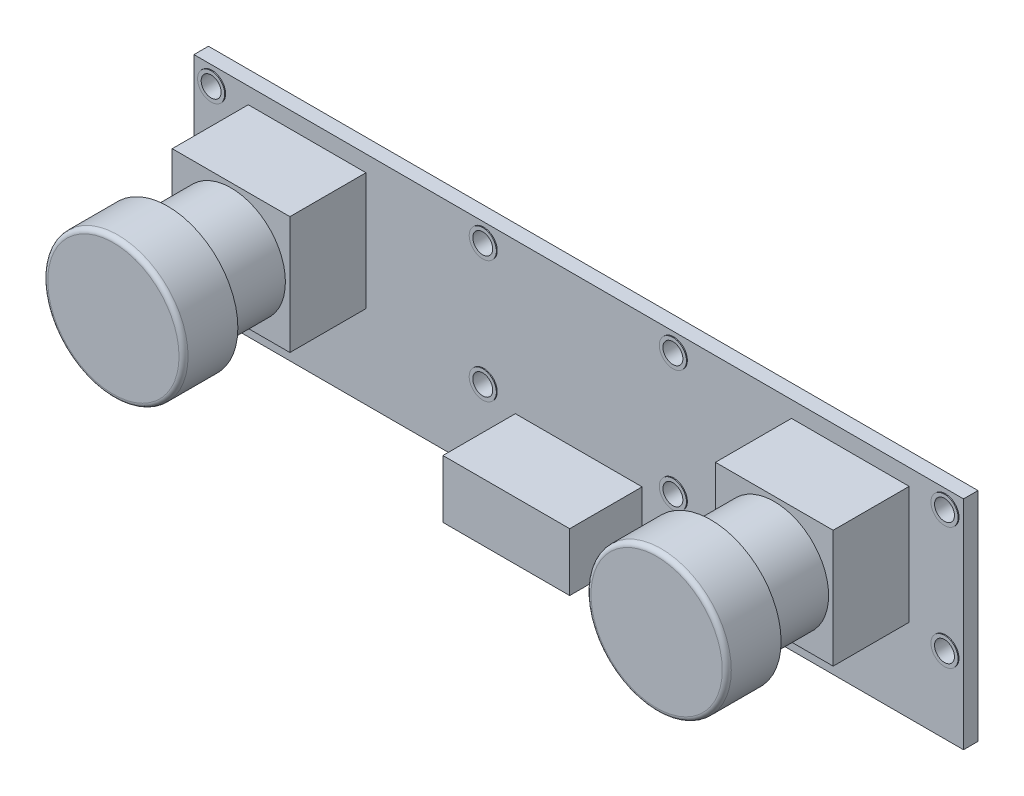
from build123d import *

# Parameters (mm, degrees)
SKETCH4_W            = 85
SKETCH4_H            = 24
BOSS_EXTRUDE4_DEPTH  = 1.6
SKETCH5_R            = 1.1
CUT_EXTRUDE1_DEPTH   = 1.6
SKETCH6_W            = 13
SKETCH6_H            = 13
BOSS_EXTRUDE5_DEPTH  = 8.4
SKETCH7_R            = 6
BOSS_EXTRUDE6_DEPTH  = 7
SKETCH8_R            = 7.75
BOSS_EXTRUDE7_DEPTH  = 6
SKETCH9_R            = 6
BOSS_EXTRUDE8_DEPTH  = 7
SKETCH10_R           = 7.75
BOSS_EXTRUDE9_DEPTH  = 6
BOSS_EXTRUDE10_DEPTH = 8
SKETCH12_W           = 14
SKETCH12_H           = 1
CUT_EXTRUDE2_DEPTH   = 8
SHELL1_START         = 1
SHELL1_OUTLINE_W     = 12
SHELL1_OUTLINE_H     = 5.4
SHELL1_DEPTH         = 7.6
SKETCH14_R           = 0.75
BOSS_EXTRUDE11_DEPTH = 5
FILLET1_R            = 0.5
FILLET2_R            = 0.5
BOSS_EXTRUDE12_START = 0.1
SKETCH15_R           = 1.5
SKETCH15_R_2         = 1.1
BOSS_EXTRUDE12_DEPTH = 0.1


# Read off the part's stored shape, not the designer's step: Shell1
with BuildPart() as part:
    # Sketch4 → Boss-Extrude4 (new body)
    with BuildSketch(Plane.XY):
        Rectangle(SKETCH4_W, SKETCH4_H)
    extrude(amount=BOSS_EXTRUDE4_DEPTH)

    # Sketch5 → Cut-Extrude1 (cut)
    with BuildSketch(Plane.XY.offset(1.6)):
        with Locations((-40.5, 10)):
            Circle(SKETCH5_R)
        with Locations((-40.5, -3.5)):
            Circle(SKETCH5_R)
        with Locations((-10.5, -3.5)):
            Circle(SKETCH5_R)
        with Locations((-10.5, 10)):
            Circle(SKETCH5_R)
        with Locations((10.5, 10)):
            Circle(SKETCH5_R)
        with Locations((10.5, -3.5)):
            Circle(SKETCH5_R)
        with Locations((40.5, 10)):
            Circle(SKETCH5_R)
        with Locations((40.5, -3.5)):
            Circle(SKETCH5_R)
    extrude(amount=-CUT_EXTRUDE1_DEPTH, mode=Mode.SUBTRACT)

    # Sketch6 → Boss-Extrude5 (add)
    with BuildSketch(Plane.XY.offset(1.6)):
        with Locations((-30, 3.7)):
            Rectangle(SKETCH6_W, SKETCH6_H)
        with Locations((30, 3.7)):
            Rectangle(SKETCH6_W, SKETCH6_H)
    extrude(amount=BOSS_EXTRUDE5_DEPTH)

    # Sketch7 → Boss-Extrude6 (add)
    with BuildSketch(Plane.XY.offset(10)):
        with Locations((-30, 3.7)):
            Circle(SKETCH7_R)
    extrude(amount=BOSS_EXTRUDE6_DEPTH)

    # Sketch8 → Boss-Extrude7 (add)
    with BuildSketch(Plane.XY.offset(17)):
        with Locations((-30, 3.7)):
            Circle(SKETCH8_R)
    extrude(amount=BOSS_EXTRUDE7_DEPTH)

    # Sketch11 → Boss-Extrude10 (add)
    with BuildSketch(Plane.XY.offset(1.6)):
        Polygon((0, -12), (7, -12), (7, -4.6), (-7, -4.6), (-7, -12), align=None)
    extrude(amount=BOSS_EXTRUDE10_DEPTH)

    # Sketch12 → Cut-Extrude2 (cut)
    with BuildSketch(Plane.XY.offset(9.6)):
        with Locations((0, -11.5)):
            Rectangle(SKETCH12_W, SKETCH12_H)
    extrude(amount=-CUT_EXTRUDE2_DEPTH, mode=Mode.SUBTRACT)

    # Shell1 outline → Shell1 (cut)
    with BuildSketch(Plane.XY.offset(SHELL1_START)):
        with Locations((0, -8.3)):
            Rectangle(SHELL1_OUTLINE_W, SHELL1_OUTLINE_H)
    extrude(amount=SHELL1_DEPTH, mode=Mode.SUBTRACT)

    # Sketch14 → Boss-Extrude11 (add)
    with BuildSketch(Plane(origin=(0, -5.6, 0), x_dir=(-1, 0, 0), z_dir=(0, -1, 0))):
        with Locations(Location((5, -5, 0), (0, 0, 90))):
            Circle(SKETCH14_R)
        with Locations(Location((-5, -5, 0), (0, 0, 90))):
            Circle(SKETCH14_R)
        with Locations(Location((1.666666667, -5, 0), (0, 0, 90))):
            Circle(SKETCH14_R)
        with Locations(Location((-1.668333333, -5, 0), (0, 0, 90))):
            Circle(SKETCH14_R)
    extrude(amount=BOSS_EXTRUDE11_DEPTH)

    # Fillet1
    fillet1_edges = [part.edges().sort_by_distance(p)[0] for p in [
        (-37.75, 3.7, 23),
    ]]
    fillet(fillet1_edges, radius=FILLET1_R)

    # Sketch15 → Boss-Extrude12 (add)
    # profile 1 of 8: a face of its own
    with BuildSketch(Plane.XY.offset(1.6).offset(BOSS_EXTRUDE12_START)):
        with Locations(Location((-10.5, 10, 0), (0, 0, 180))):
            Circle(SKETCH15_R)
        with Locations((-10.5, 10)):
            Circle(SKETCH15_R_2, mode=Mode.SUBTRACT)
    # profile 2 of 8: a face of its own
    with BuildSketch(Plane.XY.offset(1.6).offset(BOSS_EXTRUDE12_START)):
        with Locations(Location((-10.5, -3.5, 0), (0, 0, 180))):
            Circle(SKETCH15_R)
        with Locations((-10.5, -3.5)):
            Circle(SKETCH15_R_2, mode=Mode.SUBTRACT)
    # profile 3 of 8: a face of its own
    with BuildSketch(Plane.XY.offset(1.6).offset(BOSS_EXTRUDE12_START)):
        with Locations(Location((-40.5, 10, 0), (0, 0, 180))):
            Circle(SKETCH15_R)
        with Locations((-40.5, 10)):
            Circle(SKETCH15_R_2, mode=Mode.SUBTRACT)
    # profile 4 of 8: a face of its own
    with BuildSketch(Plane.XY.offset(1.6).offset(BOSS_EXTRUDE12_START)):
        with Locations(Location((-40.5, -3.5, 0), (0, 0, 180))):
            Circle(SKETCH15_R)
        with Locations((-40.5, -3.5)):
            Circle(SKETCH15_R_2, mode=Mode.SUBTRACT)
    # profile 5 of 8: a face of its own
    with BuildSketch(Plane.XY.offset(1.6).offset(BOSS_EXTRUDE12_START)):
        with Locations(Location((10.5, 10, 0), (0, 0, 180))):
            Circle(SKETCH15_R)
        with Locations((10.5, 10)):
            Circle(SKETCH15_R_2, mode=Mode.SUBTRACT)
    # profile 6 of 8: a face of its own
    with BuildSketch(Plane.XY.offset(1.6).offset(BOSS_EXTRUDE12_START)):
        with Locations(Location((10.5, -3.5, 0), (0, 0, 180))):
            Circle(SKETCH15_R)
        with Locations((10.5, -3.5)):
            Circle(SKETCH15_R_2, mode=Mode.SUBTRACT)
    # profile 7 of 8: a face of its own
    with BuildSketch(Plane.XY.offset(1.6).offset(BOSS_EXTRUDE12_START)):
        with Locations(Location((40.5, 10, 0), (0, 0, 180))):
            Circle(SKETCH15_R)
        with Locations((40.5, 10)):
            Circle(SKETCH15_R_2, mode=Mode.SUBTRACT)
    # profile 8 of 8: a face of its own
    with BuildSketch(Plane.XY.offset(1.6).offset(BOSS_EXTRUDE12_START)):
        with Locations(Location((40.5, -3.5, 0), (0, 0, 180))):
            Circle(SKETCH15_R)
        with Locations((40.5, -3.5)):
            Circle(SKETCH15_R_2, mode=Mode.SUBTRACT)
    extrude(amount=-BOSS_EXTRUDE12_DEPTH)


with BuildPart() as body_2:
    # Sketch9 → Boss-Extrude8 (new body)
    with BuildSketch(Plane.XY.offset(10)):
        with Locations((30, 3.7)):
            Circle(SKETCH9_R)
    extrude(amount=BOSS_EXTRUDE8_DEPTH)


with BuildPart() as body_3:
    # Sketch10 → Boss-Extrude9 (new body)
    with BuildSketch(Plane.XY.offset(17)):
        with Locations((30, 3.7)):
            Circle(SKETCH10_R)
    extrude(amount=BOSS_EXTRUDE9_DEPTH)

    # Fillet2
    fillet2_edges = [body_3.edges().sort_by_distance(p)[0] for p in [
        (22.25, 3.7, 23),
    ]]
    fillet(fillet2_edges, radius=FILLET2_R)


solid = Compound([part.part, body_2.part, body_3.part])
